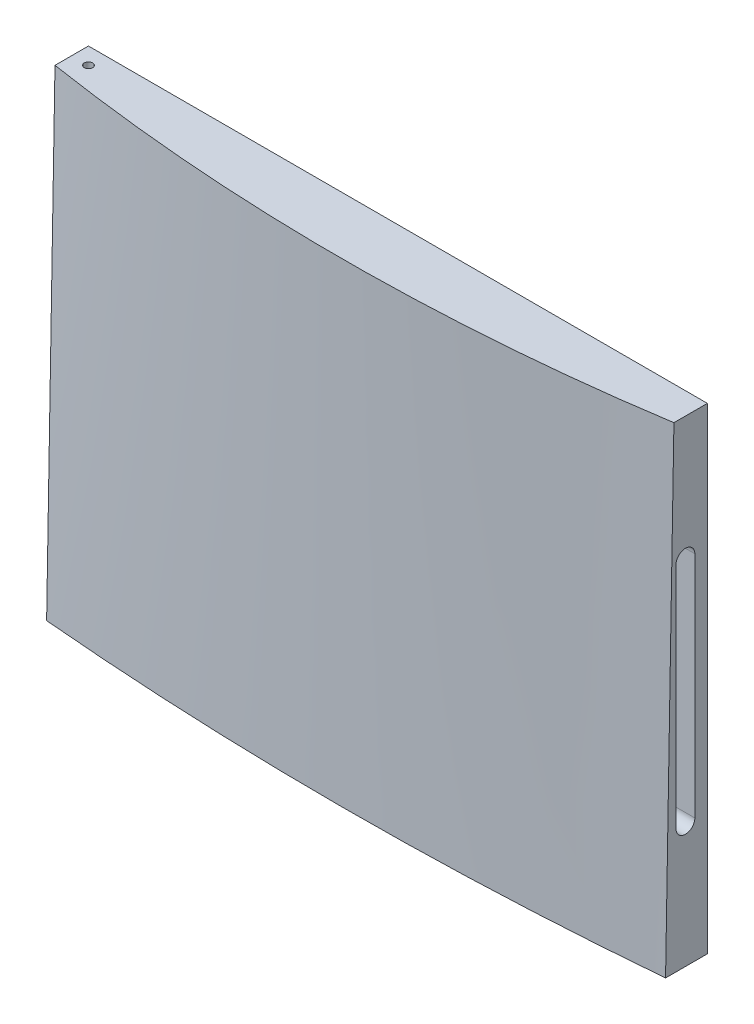
from build123d import *

# Parameters (mm, degrees)
CORTE_EXTRUS_O3_REACH    = 685.022
ESBO_O5_R                = 5
CORTE_EXTRUS_O4_DEPTH    = 10
ESBO_O8_W                = 680
ESBO_O8_H                = 510
RESSALTO_EXTRUS_O1_DEPTH = 20
FILETE1_R                = 10
CORTE_EXTRUS_O5_DEPTH    = 35
FILETE17_R               = 10


with BuildPart() as part:
    # Esboço2 for Loft1 → Loft1 section 0
    with BuildSketch(Plane(origin=(0, 570, 0), x_dir=(1, 0, 0), z_dir=(0, 1, 0))):
        with BuildLine():
            Line((-370, 0), (370, 0))
            Line((370, 0), (370, -40))
            # circular arc as an exact rational Bezier (weights 1, cos(half-angle), 1)
            Bezier((370, -40), (0, -97.731859317), (-370, -40), weights=[1, 0.988044857, 1])
            Line((-370, -40), (-370, 0))
        make_face()
    # Esboço1 for Loft1 → Loft1 section 1
    with BuildSketch(Plane(origin=(0, 0, 0), x_dir=(1, 0, 0), z_dir=(0, 1, 0))):
        with BuildLine():
            Line((-370, 0), (370, 0))
            Line((370, 0), (370, -50))
            Bezier((370, -50), (0, -82.722461177), (-370, -50), weights=[1, 0.996112056, 1])
            Line((-370, -50), (-370, 0))
        make_face()
    loft()

    # Esboço5 → Corte-extrusão3 (cut, up to next)
    with BuildSketch(Plane.XZ, mode=Mode.PRIVATE) as corte_extrus_o3_sk1:
        with Locations(Location((-350, 20, 0), (0, 0, 270))):
            Circle(ESBO_O5_R)
    corte_extrus_o3_tool1 = extrude(corte_extrus_o3_sk1.sketch, amount=-CORTE_EXTRUS_O3_REACH, mode=Mode.PRIVATE) & part.part
    add(corte_extrus_o3_tool1.solids().sort_by_distance((-350, 0, 20))[0], mode=Mode.SUBTRACT)

    # Esboço6 → Corte-extrusão4 (cut)
    with BuildSketch(Plane.XZ):
        with BuildLine():
            Line((-370, 0), (-320.856761827, 0))
            Line((-320.856761827, 0), (-320.856761827, 10.441916975))
            ThreePointArc((-320.856761827, 10.441916975), (-325.250160109, 21.048518693), (-335.856761827, 25.441916975))
            Line((-335.856761827, 25.441916975), (-370, 25.441916975))
            Line((-370, 25.441916975), (-370, 0))
        make_face()
    extrude(amount=-CORTE_EXTRUS_O4_DEPTH, mode=Mode.SUBTRACT)

    # Esboço8 → Ressalto-extrusão1 (add)
    with BuildSketch(Plane(origin=(0, 0, 0), x_dir=(-1, 0, 0), z_dir=(0, 0, -1))):
        with Locations((-5, 290)):
            Rectangle(ESBO_O8_W, ESBO_O8_H)
    extrude(amount=RESSALTO_EXTRUS_O1_DEPTH)

    # Filete1
    filete1_edges = [part.edges().sort_by_distance(p)[0] for p in [
        (-335, 290, 0),
        (-335, 35, -10),
        (5, 545, 0),
        (-335, 545, -10),
        (345, 290, 0),
        (345, 545, -10),
        (5, 35, 0),
        (345, 35, -10),
        (-335, 290, -20),
        (345, 290, -20),
        (5, 35, -20),
    ]]
    fillet(filete1_edges, radius=FILETE1_R - 0.0001)  # a hair under: the kernel refuses the full size

    # Esboço11 → Corte-extrusão5 (cut)
    with BuildSketch(Plane(origin=(370, 0, 0), x_dir=(0, 0, -1), z_dir=(1, 0, 0))):
        with BuildLine():
            Line((-37.5, 148.2), (-37.5, 421.8))
            ThreePointArc((-37.5, 421.8), (-26.25, 433.05), (-15, 421.8))
            Line((-15, 421.8), (-15, 148.2))
            ThreePointArc((-15, 148.2), (-26.25, 136.95), (-37.5, 148.2))
        make_face()
    extrude(amount=-CORTE_EXTRUS_O5_DEPTH, mode=Mode.SUBTRACT)

    # Filete17
    filete17_edges = [part.edges().sort_by_distance(p)[0] for p in [
        (335, 136.95, 26.25),
        (335, 285, 37.5),
        (335, 433.05, 26.25),
        (335, 285, 15),
    ]]
    fillet(filete17_edges, radius=FILETE17_R)


solid = part.part
